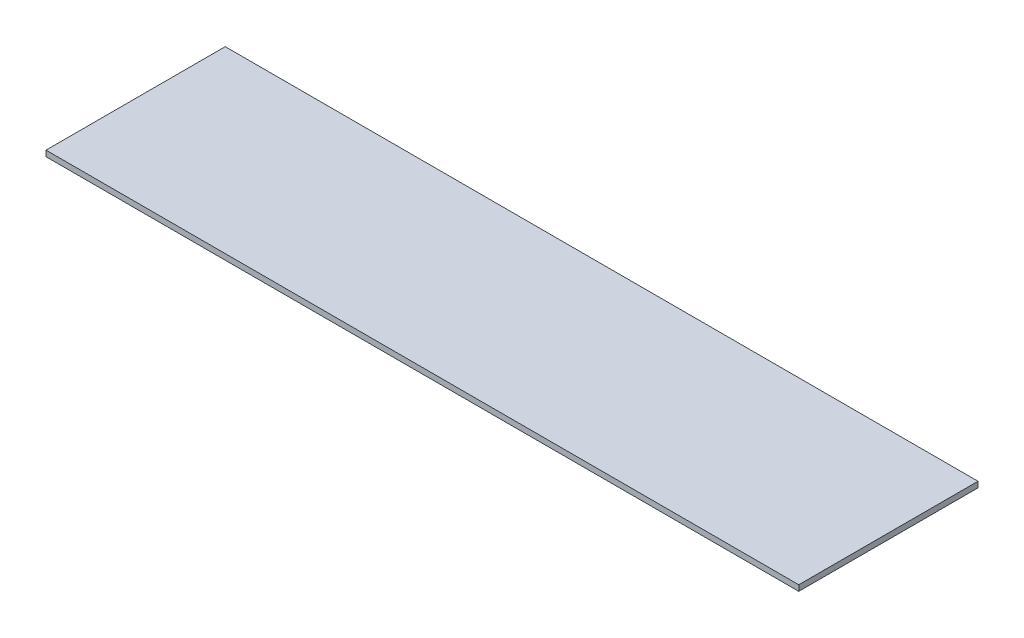
from build123d import *

# Parameters (mm, degrees)
SKETCH1_W           = 133.35
SKETCH1_H           = 31.75
BOSS_EXTRUDE1_DEPTH = 0.508


with BuildPart() as part:
    # Sketch1 → Boss-Extrude1 (new, symmetric)
    with BuildSketch(Plane(origin=(0, 0, 0), x_dir=(1, 0, 0), z_dir=(0, 1, 0))):
        Rectangle(SKETCH1_W, SKETCH1_H)
    extrude(amount=BOSS_EXTRUDE1_DEPTH, both=True)


solid = part.part
